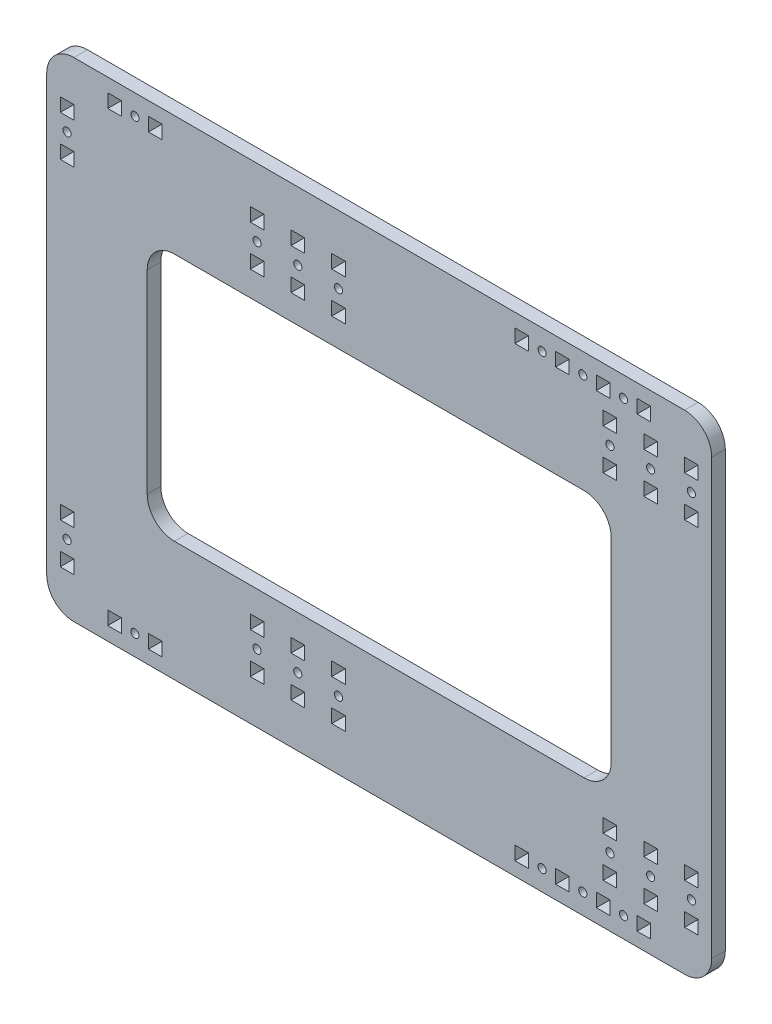
from build123d import *

# Parameters (mm, degrees)
SKETCH1_W           = 245.000446045
SKETCH1_H           = 180
SKETCH1_W_2         = 5
SKETCH1_H_2         = 5
SKETCH1_R           = 1.5
SKETCH1_W_3         = 170.94983484
SKETCH1_H_3         = 91.62405016
BOSS_EXTRUDE1_DEPTH = 5
FILLET1_R           = 10


with BuildPart() as part:
    # Sketch1 → Boss-Extrude1 (new body)
    with BuildSketch(Plane.XY):
        with Locations((31.175821468, 0)):
            Rectangle(SKETCH1_W, SKETCH1_H)
        with Locations((-66.324847601, -82.5)):
            Rectangle(SKETCH1_W_2, SKETCH1_H_2, mode=Mode.SUBTRACT)
        with Locations((-83.824401555, -72.5)):
            Rectangle(SKETCH1_W_2, SKETCH1_H_2, mode=Mode.SUBTRACT)
        with Locations((-58.824847601, -82.5)):
            Circle(SKETCH1_R, mode=Mode.SUBTRACT)
        with Locations((-51.324847601, -82.5)):
            Rectangle(SKETCH1_W_2, SKETCH1_H_2, mode=Mode.SUBTRACT)
        with Locations((-83.824401555, -65)):
            Circle(SKETCH1_R, mode=Mode.SUBTRACT)
        with Locations((-83.824401555, -57.5)):
            Rectangle(SKETCH1_W_2, SKETCH1_H_2, mode=Mode.SUBTRACT)
        with Locations((-13.824401555, -72.5)):
            Rectangle(SKETCH1_W_2, SKETCH1_H_2, mode=Mode.SUBTRACT)
        with Locations((1.175598445, -72.5)):
            Rectangle(SKETCH1_W_2, SKETCH1_H_2, mode=Mode.SUBTRACT)
        with Locations((16.175598445, -72.5)):
            Rectangle(SKETCH1_W_2, SKETCH1_H_2, mode=Mode.SUBTRACT)
        with Locations((-13.824401555, -65)):
            Circle(SKETCH1_R, mode=Mode.SUBTRACT)
        with Locations((-13.824401555, -57.5)):
            Rectangle(SKETCH1_W_2, SKETCH1_H_2, mode=Mode.SUBTRACT)
        with Locations((1.175598445, -65)):
            Circle(SKETCH1_R, mode=Mode.SUBTRACT)
        with Locations((1.175598445, -57.5)):
            Rectangle(SKETCH1_W_2, SKETCH1_H_2, mode=Mode.SUBTRACT)
        with Locations((16.175598445, -65)):
            Circle(SKETCH1_R, mode=Mode.SUBTRACT)
        with Locations((16.175598445, -57.5)):
            Rectangle(SKETCH1_W_2, SKETCH1_H_2, mode=Mode.SUBTRACT)
        with Locations((83.67604449, -82.5)):
            Rectangle(SKETCH1_W_2, SKETCH1_H_2, mode=Mode.SUBTRACT)
        with Locations((91.17604449, -82.5)):
            Circle(SKETCH1_R, mode=Mode.SUBTRACT)
        with Locations((98.67604449, -82.5)):
            Rectangle(SKETCH1_W_2, SKETCH1_H_2, mode=Mode.SUBTRACT)
        with Locations((106.17604449, -82.5)):
            Circle(SKETCH1_R, mode=Mode.SUBTRACT)
        with Locations((113.67604449, -82.5)):
            Rectangle(SKETCH1_W_2, SKETCH1_H_2, mode=Mode.SUBTRACT)
        with Locations((121.17604449, -82.5)):
            Circle(SKETCH1_R, mode=Mode.SUBTRACT)
        with Locations((116.17604449, -72.5)):
            Rectangle(SKETCH1_W_2, SKETCH1_H_2, mode=Mode.SUBTRACT)
        with Locations((128.67604449, -82.5)):
            Rectangle(SKETCH1_W_2, SKETCH1_H_2, mode=Mode.SUBTRACT)
        with Locations((131.17604449, -72.5)):
            Rectangle(SKETCH1_W_2, SKETCH1_H_2, mode=Mode.SUBTRACT)
        with Locations((146.17604449, -72.5)):
            Rectangle(SKETCH1_W_2, SKETCH1_H_2, mode=Mode.SUBTRACT)
        with Locations((116.17604449, -65)):
            Circle(SKETCH1_R, mode=Mode.SUBTRACT)
        with Locations((116.17604449, -57.5)):
            Rectangle(SKETCH1_W_2, SKETCH1_H_2, mode=Mode.SUBTRACT)
        with Locations((131.17604449, -65)):
            Circle(SKETCH1_R, mode=Mode.SUBTRACT)
        with Locations((131.17604449, -57.5)):
            Rectangle(SKETCH1_W_2, SKETCH1_H_2, mode=Mode.SUBTRACT)
        with Locations((146.17604449, -65)):
            Circle(SKETCH1_R, mode=Mode.SUBTRACT)
        with Locations((146.17604449, -57.5)):
            Rectangle(SKETCH1_W_2, SKETCH1_H_2, mode=Mode.SUBTRACT)
        with Locations((31.175821467, 0)):
            Rectangle(SKETCH1_W_3, SKETCH1_H_3, mode=Mode.SUBTRACT)
        with Locations((-83.824401555, 57.5)):
            Rectangle(SKETCH1_W_2, SKETCH1_H_2, mode=Mode.SUBTRACT)
        with Locations((-83.824401555, 65)):
            Circle(SKETCH1_R, mode=Mode.SUBTRACT)
        with Locations((-83.824401555, 72.5)):
            Rectangle(SKETCH1_W_2, SKETCH1_H_2, mode=Mode.SUBTRACT)
        with Locations((-66.324847601, 82.5)):
            Rectangle(SKETCH1_W_2, SKETCH1_H_2, mode=Mode.SUBTRACT)
        with Locations((-58.824847601, 82.5)):
            Circle(SKETCH1_R, mode=Mode.SUBTRACT)
        with Locations((-51.324847601, 82.5)):
            Rectangle(SKETCH1_W_2, SKETCH1_H_2, mode=Mode.SUBTRACT)
        with Locations((-13.824401555, 57.5)):
            Rectangle(SKETCH1_W_2, SKETCH1_H_2, mode=Mode.SUBTRACT)
        with Locations((-13.824401555, 65)):
            Circle(SKETCH1_R, mode=Mode.SUBTRACT)
        with Locations((1.175598445, 57.5)):
            Rectangle(SKETCH1_W_2, SKETCH1_H_2, mode=Mode.SUBTRACT)
        with Locations((1.175598445, 65)):
            Circle(SKETCH1_R, mode=Mode.SUBTRACT)
        with Locations((16.175598445, 57.5)):
            Rectangle(SKETCH1_W_2, SKETCH1_H_2, mode=Mode.SUBTRACT)
        with Locations((16.175598445, 65)):
            Circle(SKETCH1_R, mode=Mode.SUBTRACT)
        with Locations((-13.824401555, 72.5)):
            Rectangle(SKETCH1_W_2, SKETCH1_H_2, mode=Mode.SUBTRACT)
        with Locations((1.175598445, 72.5)):
            Rectangle(SKETCH1_W_2, SKETCH1_H_2, mode=Mode.SUBTRACT)
        with Locations((16.175598445, 72.5)):
            Rectangle(SKETCH1_W_2, SKETCH1_H_2, mode=Mode.SUBTRACT)
        with Locations((83.676044481, 82.5)):
            Rectangle(SKETCH1_W_2, SKETCH1_H_2, mode=Mode.SUBTRACT)
        with Locations((91.176044481, 82.5)):
            Circle(SKETCH1_R, mode=Mode.SUBTRACT)
        with Locations((116.17604449, 57.5)):
            Rectangle(SKETCH1_W_2, SKETCH1_H_2, mode=Mode.SUBTRACT)
        with Locations((116.17604449, 65)):
            Circle(SKETCH1_R, mode=Mode.SUBTRACT)
        with Locations((131.17604449, 57.5)):
            Rectangle(SKETCH1_W_2, SKETCH1_H_2, mode=Mode.SUBTRACT)
        with Locations((131.17604449, 65)):
            Circle(SKETCH1_R, mode=Mode.SUBTRACT)
        with Locations((146.17604449, 57.5)):
            Rectangle(SKETCH1_W_2, SKETCH1_H_2, mode=Mode.SUBTRACT)
        with Locations((146.17604449, 65)):
            Circle(SKETCH1_R, mode=Mode.SUBTRACT)
        with Locations((116.17604449, 72.5)):
            Rectangle(SKETCH1_W_2, SKETCH1_H_2, mode=Mode.SUBTRACT)
        with Locations((98.67604449, 82.5)):
            Rectangle(SKETCH1_W_2, SKETCH1_H_2, mode=Mode.SUBTRACT)
        with Locations((106.17604449, 82.5)):
            Circle(SKETCH1_R, mode=Mode.SUBTRACT)
        with Locations((113.67604449, 82.5)):
            Rectangle(SKETCH1_W_2, SKETCH1_H_2, mode=Mode.SUBTRACT)
        with Locations((121.17604449, 82.5)):
            Circle(SKETCH1_R, mode=Mode.SUBTRACT)
        with Locations((131.17604449, 72.5)):
            Rectangle(SKETCH1_W_2, SKETCH1_H_2, mode=Mode.SUBTRACT)
        with Locations((146.17604449, 72.5)):
            Rectangle(SKETCH1_W_2, SKETCH1_H_2, mode=Mode.SUBTRACT)
        with Locations((128.67604449, 82.5)):
            Rectangle(SKETCH1_W_2, SKETCH1_H_2, mode=Mode.SUBTRACT)
    extrude(amount=BOSS_EXTRUDE1_DEPTH)

    # Fillet1
    fillet1_edges = [part.edges().sort_by_distance(p)[0] for p in [
        (153.67604449, 90, 2.5),
        (153.67604449, -90, 2.5),
        (-91.324401555, -90, 2.5),
        (-91.324401555, 90, 2.5),
        (-54.299095953, -45.81202508, 2.5),
        (116.650738887, -45.81202508, 2.5),
        (116.650738887, 45.81202508, 2.5),
        (-54.299095953, 45.81202508, 2.5),
    ]]
    fillet(fillet1_edges, radius=FILLET1_R)


solid = part.part
